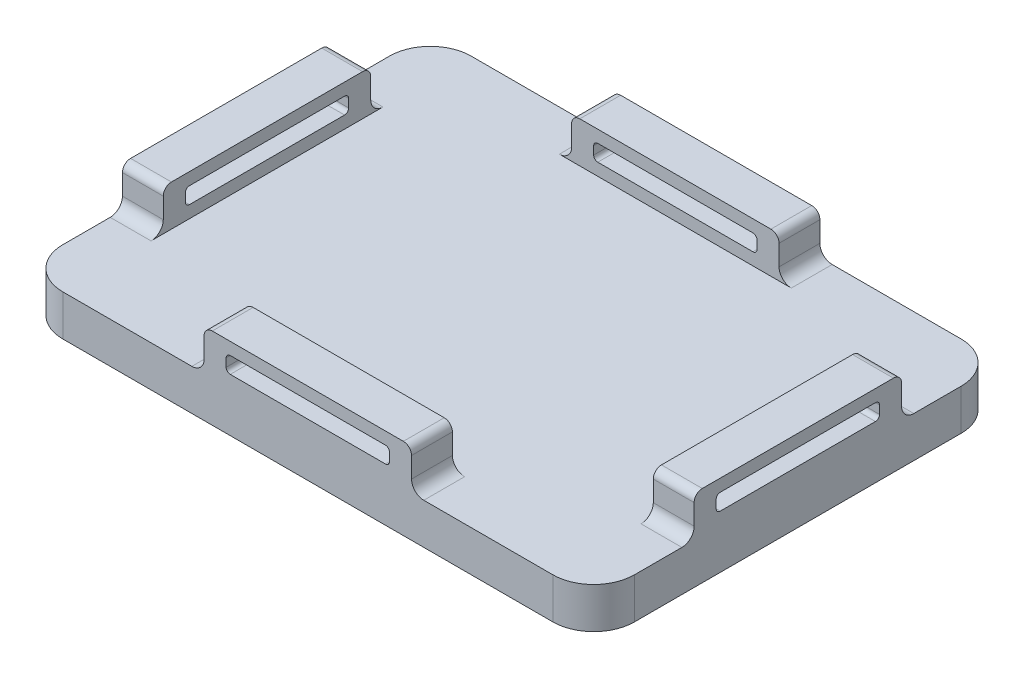
from build123d import *

# Parameters (mm, degrees)
BOSS_EXTRUDE1_DEPTH = 5
SKETCH2_W           = 3
SKETCH2_H           = 12
SKETCH2_W_2         = 12
SKETCH2_H_2         = 3
BOSS_EXTRUDE2_DEPTH = 10
SKETCH3_W           = 5
SKETCH3_H           = 25.4
SKETCH3_W_2         = 25.4
SKETCH3_H_2         = 5
BOSS_EXTRUDE3_DEPTH = 5
CUT_EXTRUDE1_DEPTH  = 87.602540378
CUT_EXTRUDE2_DEPTH  = 87.602540378
FILLET1_R           = 1
FILLET2_R           = 1.5
SKETCH6_R           = 1.5
CUT_EXTRUDE3_DEPTH  = 3
SKETCH7_R           = 1.5
CUT_EXTRUDE4_DEPTH  = 3
FILLET3_R           = 1.5
FILLET4_R           = 1.5


with BuildPart() as part:
    # Sketch1 → Boss-Extrude1 (new body)
    with BuildSketch(Plane(origin=(0, 0, 0), x_dir=(1, 0, 0), z_dir=(0, 1, 0))):
        with BuildLine():
            Line((5, 0), (65, 0))
            ThreePointArc((65, 0), (68.535533906, 1.464466094), (70, 5))
            Line((70, 5), (70, 45))
            ThreePointArc((70, 45), (68.535533906, 48.535533906), (65, 50))
            Line((65, 50), (5, 50))
            ThreePointArc((5, 50), (1.464466094, 48.535533906), (0, 45))
            Line((0, 45), (0, 5))
            ThreePointArc((0, 5), (1.464466094, 1.464466094), (5, 0))
        make_face()
    extrude(amount=BOSS_EXTRUDE1_DEPTH)

    # Sketch2 → Boss-Extrude2 (add)
    with BuildSketch(Plane.XZ):
        with Locations((13.5, -25)):
            Rectangle(SKETCH2_W, SKETCH2_H)
        with Locations((52, -25)):
            Rectangle(SKETCH2_W_2, SKETCH2_H_2)
    extrude(amount=BOSS_EXTRUDE2_DEPTH)

    # Sketch3 → Boss-Extrude3 (add)
    with BuildSketch(Plane(origin=(0, 5, 0), x_dir=(1, 0, 0), z_dir=(0, 1, 0))):
        with Locations((2.5, 25)):
            Rectangle(SKETCH3_W, SKETCH3_H)
        with Locations((67.5, 25)):
            Rectangle(SKETCH3_W, SKETCH3_H)
        with Locations((35, 47.5)):
            Rectangle(SKETCH3_W_2, SKETCH3_H_2)
        with Locations((35, 2.5)):
            Rectangle(SKETCH3_W_2, SKETCH3_H_2)
    extrude(amount=BOSS_EXTRUDE3_DEPTH)

    # Sketch4 → Cut-Extrude1 (cut, through all)
    with BuildSketch(Plane.ZY):
        with BuildLine():
            Line((-34.5, 8.5), (-15.5, 8.5))
            ThreePointArc((-15.5, 8.5), (-15.146446609, 8.353553391), (-15, 8))
            Line((-15, 8), (-15, 7))
            ThreePointArc((-15, 7), (-15.146446609, 6.646446609), (-15.5, 6.5))
            Line((-15.5, 6.5), (-34.5, 6.5))
            ThreePointArc((-34.5, 6.5), (-34.853553391, 6.646446609), (-35, 7))
            Line((-35, 7), (-35, 8))
            ThreePointArc((-35, 8), (-34.853553391, 8.353553391), (-34.5, 8.5))
        make_face()
    extrude(amount=-CUT_EXTRUDE1_DEPTH, mode=Mode.SUBTRACT)

    # Sketch5 → Cut-Extrude2 (cut, through all)
    with BuildSketch(Plane.XY):
        with BuildLine():
            Line((25.5, 8.5), (44.5, 8.5))
            ThreePointArc((44.5, 8.5), (44.853553391, 8.353553391), (45, 8))
            Line((45, 8), (45, 7))
            ThreePointArc((45, 7), (44.853553391, 6.646446609), (44.5, 6.5))
            Line((44.5, 6.5), (25.5, 6.5))
            ThreePointArc((25.5, 6.5), (25.146446609, 6.646446609), (25, 7))
            Line((25, 7), (25, 8))
            ThreePointArc((25, 8), (25.146446609, 8.353553391), (25.5, 8.5))
        make_face()
    extrude(amount=-CUT_EXTRUDE2_DEPTH, mode=Mode.SUBTRACT)

    # Fillet1
    fillet1_edges = [part.edges().sort_by_distance(p)[0] for p in [
        (67.5, 10, -37.7),
        (67.5, 10, -12.3),
        (2.5, 10, -12.3),
        (2.5, 10, -37.7),
        (22.3, 10, -47.5),
        (47.7, 10, -47.5),
        (22.3, 10, -2.5),
        (47.7, 10, -2.5),
    ]]
    fillet(fillet1_edges, radius=FILLET1_R)

    # Fillet2
    fillet2_edges = [part.edges().sort_by_distance(p)[0] for p in [
        (22.3, 5, -2.5),
        (47.7, 5, -2.5),
        (67.5, 5, -12.3),
        (67.5, 5, -37.7),
        (47.7, 5, -47.5),
        (22.3, 5, -47.5),
        (2.5, 5, -37.7),
        (2.5, 5, -12.3),
    ]]
    fillet(fillet2_edges, radius=FILLET2_R)

    # Sketch6 → Cut-Extrude3 (cut)
    with BuildSketch(Plane.ZY.offset(-12)):
        with Locations((-25, -5)):
            Circle(SKETCH6_R)
    extrude(amount=-CUT_EXTRUDE3_DEPTH, mode=Mode.SUBTRACT)

    # Sketch7 → Cut-Extrude4 (cut)
    with BuildSketch(Plane.XY.offset(-23.5)):
        with Locations((52, -5)):
            Circle(SKETCH7_R)
    extrude(amount=-CUT_EXTRUDE4_DEPTH, mode=Mode.SUBTRACT)

    # Fillet3
    fillet3_edges = [part.edges().sort_by_distance(p)[0] for p in [
        (58, -10, -25),
        (46, -10, -25),
        (13.5, -10, -19),
        (13.5, -10, -31),
    ]]
    fillet(fillet3_edges, radius=FILLET3_R)

    # Fillet4
    fillet4_edges = [part.edges().sort_by_distance(p)[0] for p in [
        (58, 0, -25),
        (46, 0, -25),
        (13.5, 0, -19),
        (13.5, 0, -31),
    ]]
    fillet(fillet4_edges, radius=FILLET4_R)


solid = part.part
